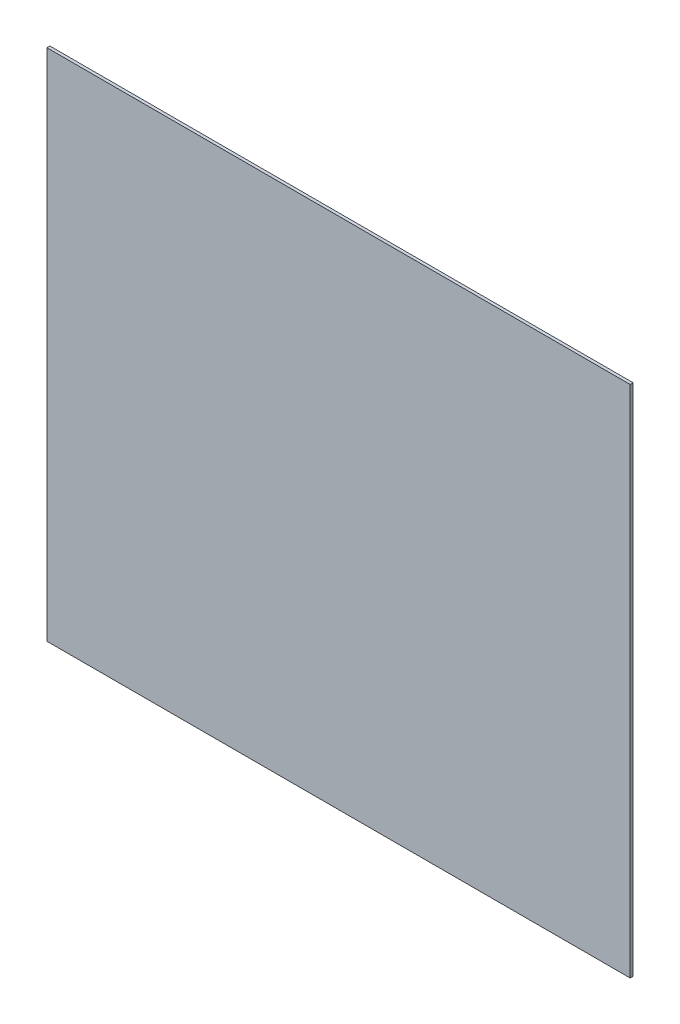
from build123d import *

# Parameters (mm, degrees)
SKETCH_1_W             = 295
SKETCH_1_H             = 260
SM_BASE_FLANGE_1_DEPTH = 1.5


# Sheet-metal steps are written as plain solids
with BuildPart() as part:
    # Sketch 1 → 基体-法兰1 (new body)
    with BuildSketch(Plane.XY):
        Rectangle(SKETCH_1_W, SKETCH_1_H)
    extrude(amount=-SM_BASE_FLANGE_1_DEPTH)


solid = part.part
